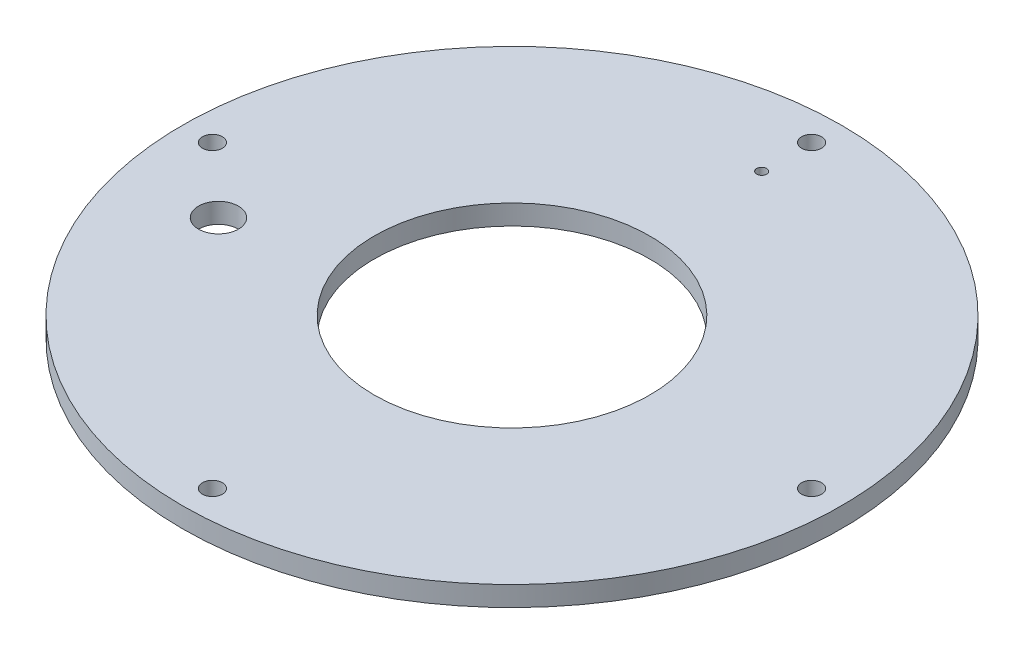
from build123d import *

# Parameters (mm, degrees)
SKETCH1_R                                       = 16.5
SKETCH1_R_2                                     = 6.9
BOSS_EXTRUDE1_DEPTH                             = 1
CSK_FOR_M2_FLAT_HEAD_MACHINE_SCREW1_D           = 1
CSK_FOR_M2_FLAT_HEAD_MACHINE_SCREW1_CSINK_D     = 1.6
CSK_FOR_M2_FLAT_HEAD_MACHINE_SCREW1_CSINK_ANGLE = 100
CUT_EXTRUDE1_DEPTH                              = 24.355941428
CUT_EXTRUDE1_DEPTH_BACK                         = 24.355941428
SKETCH4_R                                       = 0.25
SKETCH4_R_2                                     = 1


with BuildPart() as part:
    # Sketch1 → Boss-Extrude1 (new body)
    with BuildSketch(Plane(origin=(0, 0, 0), x_dir=(1, 0, 0), z_dir=(0, 1, 0))):
        Circle(SKETCH1_R)
        Circle(SKETCH1_R_2, mode=Mode.SUBTRACT)
    extrude(amount=BOSS_EXTRUDE1_DEPTH)

    # CSK for M2 Flat Head Machine Screw1 (through all)
    with Locations(Plane(origin=(0, 0, 0), x_dir=(-1, 0, 0), z_dir=(0, -1, 0))):
        with Locations((0, -15), (-15, 0), (0, 15), (15, 0)):
            CounterSinkHole(CSK_FOR_M2_FLAT_HEAD_MACHINE_SCREW1_D / 2, CSK_FOR_M2_FLAT_HEAD_MACHINE_SCREW1_CSINK_D / 2, counter_sink_angle=CSK_FOR_M2_FLAT_HEAD_MACHINE_SCREW1_CSINK_ANGLE)

    # Sketch4 → Cut-Extrude1 (cut, two sides: drawn at the far end of the back side and taken through both)
    with BuildSketch(Plane(origin=(0, 1, 0), x_dir=(1, 0, 0), z_dir=(0, 1, 0)).offset(-CUT_EXTRUDE1_DEPTH_BACK)):
        with Locations((0, 12.5)):
            Circle(SKETCH4_R)
        with Locations((-11.591109915, -3.105828541)):
            Circle(SKETCH4_R_2)
    extrude(amount=CUT_EXTRUDE1_DEPTH + CUT_EXTRUDE1_DEPTH_BACK, mode=Mode.SUBTRACT)


solid = part.part
